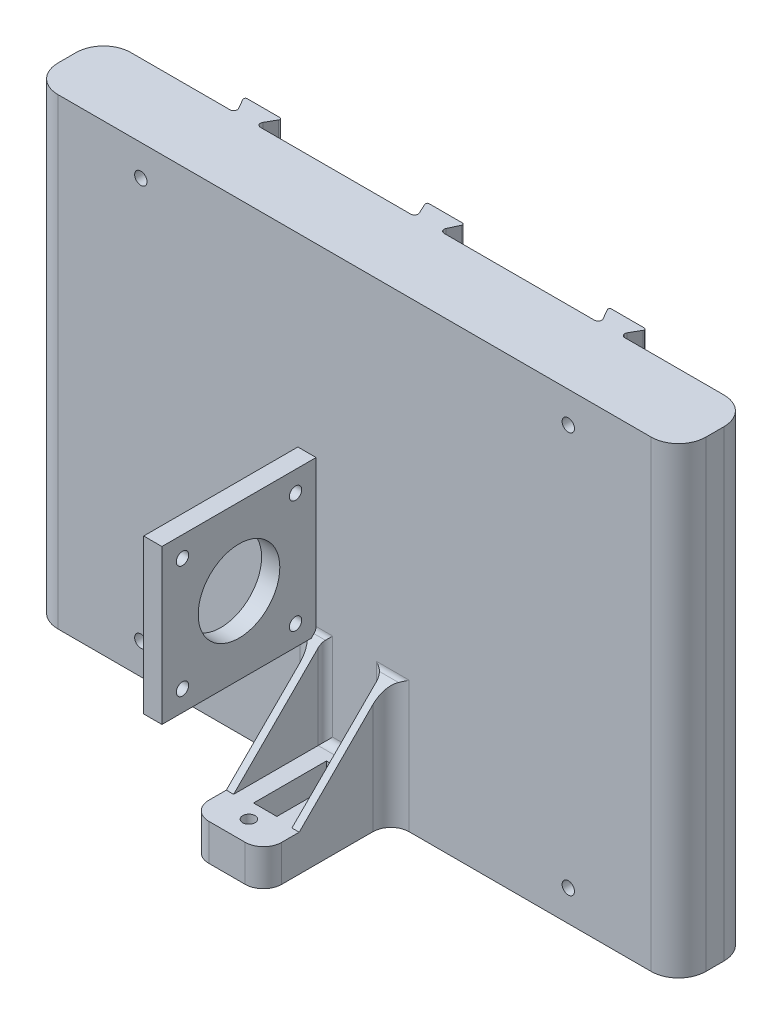
from build123d import *

# Parameters (mm, degrees)
BOSS_EXTRUDE1_DEPTH     = 127
SKETCH3_W               = 5
SKETCH3_H               = 42.3
BOSS_EXTRUDE2_DEPTH     = 42.3
SKETCH4_R               = 1.7
CUT_EXTRUDE1_DEPTH      = 5
CUT_EXTRUDE7_DEPTH      = 161.690696682
CUT_EXTRUDE7_DEPTH_BACK = 161.690696682
SKETCH5_R               = 1.7
SKETCH8_R               = 3.2
CUT_EXTRUDE8_DEPTH      = 2
SKETCH10_W              = 20
SKETCH10_H              = 10
BOSS_EXTRUDE3_DEPTH     = 35
FILLET3_R               = 5
SKETCH12_R              = 1.7
CUT_EXTRUDE9_DEPTH      = 35
RIB47_START             = -2
RIB47_DEPTH             = 2
FILLET7_R               = 5
FILLET8_R               = 2
SKETCH18_W              = 6.4
SKETCH18_H              = 20
CUT_EXTRUDE10_DEPTH     = 9
SKETCH19_W              = 5
SKETCH19_H              = 18
CUT_EXTRUDE11_DEPTH     = 4


# Read off the part's stored shape, not the designer's step: Rib47
with BuildPart() as part:
    # Sketch2 → Boss-Extrude1 (new body)
    with BuildSketch(Plane(origin=(0, 0, 0), x_dir=(1, 0, 0), z_dir=(0, 1, 0))):
        with BuildLine():
            ThreePointArc((-4.546695502, 0), (-4.968391225, -0.231350196), (-4.999849396, -0.711309131))
            Line((-4.999849396, -0.711309131), (-3.66337779, -3.577381738))
            ThreePointArc((-3.66337779, -3.577381738), (-3.726294131, -4.537299608), (-4.569685577, -5))
            Line((-4.569685577, -5), (-45.823162248, -5))
            ThreePointArc((-45.823162248, -5), (-46.689187651, -4.5), (-46.689187651, -3.5))
            Line((-46.689187651, -3.5), (-45.101474411, -0.75))
            ThreePointArc((-45.101474411, -0.75), (-45.101474411, -0.25), (-45.534487113, 0))
            Line((-45.534487113, 0), (-54.465512887, 0))
            ThreePointArc((-54.465512887, 0), (-54.898525589, -0.25), (-54.898525589, -0.75))
            Line((-54.898525589, -0.75), (-53.310812349, -3.5))
            ThreePointArc((-53.310812349, -3.5), (-53.310812349, -4.5), (-54.176837752, -5))
            Line((-54.176837752, -5), (-81.4, -5))
            ThreePointArc((-81.4, -5), (-86.703300859, -7.196699141), (-88.9, -12.5))
            Line((-88.9, -12.5), (-88.9, -17.5))
            ThreePointArc((-88.9, -17.5), (-86.703300859, -22.803300859), (-81.4, -25))
            Line((-81.4, -25), (81.4, -25))
            ThreePointArc((81.4, -25), (86.703300859, -22.803300859), (88.9, -17.5))
            Line((88.9, -17.5), (88.9, -12.5))
            ThreePointArc((88.9, -12.5), (86.703300859, -7.196699141), (81.4, -5))
            Line((81.4, -5), (54.176837752, -5))
            ThreePointArc((54.176837752, -5), (53.310812349, -4.5), (53.310812349, -3.5))
            Line((53.310812349, -3.5), (54.898525589, -0.75))
            ThreePointArc((54.898525589, -0.75), (54.898525589, -0.25), (54.465512887, 0))
            Line((54.465512887, 0), (45.534487113, 0))
            ThreePointArc((45.534487113, 0), (45.101474411, -0.25), (45.101474411, -0.75))
            Line((45.101474411, -0.75), (46.689187651, -3.5))
            ThreePointArc((46.689187651, -3.5), (46.689187651, -4.5), (45.823162248, -5))
            Line((45.823162248, -5), (4.569685577, -5))
            ThreePointArc((4.569685577, -5), (3.726294131, -4.537299608), (3.66337779, -3.577381738))
            Line((3.66337779, -3.577381738), (4.999849396, -0.711309131))
            ThreePointArc((4.999849396, -0.711309131), (4.968391225, -0.231350196), (4.546695502, 0))
            Line((4.546695502, 0), (-4.546695502, 0))
        make_face()
    extrude(amount=BOSS_EXTRUDE1_DEPTH)

    # Sketch3 → Boss-Extrude2 (add)
    with BuildSketch(Plane.XY.offset(25)):
        with Locations((-13.06, 55.018873206)):
            Rectangle(SKETCH3_W, SKETCH3_H)
    extrude(amount=BOSS_EXTRUDE2_DEPTH)

    # Sketch4 → Cut-Extrude1 (cut)
    with BuildSketch(Plane(origin=(-10.56, 0, 0), x_dir=(0, 0, -1), z_dir=(1, 0, 0))):
        with BuildLine():
            ThreePointArc((-34.95, 55.018873206), (-46.15, 66.218873206), (-57.35, 55.018873206))
            Line((-57.35, 55.018873206), (-34.95, 55.018873206))
        make_face()
        with BuildLine():
            Line((-34.95, 55.018873206), (-57.35, 55.018873206))
            ThreePointArc((-57.35, 55.018873206), (-46.15, 43.818873206), (-34.95, 55.018873206))
        make_face()
        with Locations((-61.65, 70.518873206)):
            Circle(SKETCH4_R)
        with Locations((-30.65, 70.518873206)):
            Circle(SKETCH4_R)
        with Locations((-30.65, 39.518873206)):
            Circle(SKETCH4_R)
        with Locations((-61.65, 39.518873206)):
            Circle(SKETCH4_R)
    extrude(amount=-CUT_EXTRUDE1_DEPTH, mode=Mode.SUBTRACT)

    # Sketch5 → Cut-Extrude7 (cut, two sides: drawn at the far end of the back side and taken through both)
    with BuildSketch(Plane.XY.offset(25).offset(-CUT_EXTRUDE7_DEPTH_BACK)):
        with Locations((-58.65, 118.5)):
            Circle(SKETCH5_R)
        with Locations(Location((58.65, 118.5, 0), (0, 0, 180))):
            Circle(SKETCH5_R)
        with Locations(Location((58.65, 8.5, 0), (0, 0, 180))):
            Circle(SKETCH5_R)
        with Locations((-58.65, 8.5)):
            Circle(SKETCH5_R)
    extrude(amount=CUT_EXTRUDE7_DEPTH + CUT_EXTRUDE7_DEPTH_BACK, mode=Mode.SUBTRACT)

    # Sketch8 → Cut-Extrude8 (cut)
    with BuildSketch(Plane(origin=(0, 0, 5), x_dir=(-1, 0, 0), z_dir=(0, 0, -1))):
        with Locations((-58.65, 118.5)):
            Circle(SKETCH8_R)
        with Locations((-58.65, 8.5)):
            Circle(SKETCH8_R)
        with Locations((58.65, 118.5)):
            Circle(SKETCH8_R)
        with Locations((58.65, 8.5)):
            Circle(SKETCH8_R)
    extrude(amount=-CUT_EXTRUDE8_DEPTH, mode=Mode.SUBTRACT)

    # Sketch10 → Boss-Extrude3 (add)
    with BuildSketch(Plane.XY.offset(25)):
        with Locations((0, 5)):
            Rectangle(SKETCH10_W, SKETCH10_H)
    extrude(amount=BOSS_EXTRUDE3_DEPTH)

    # Fillet3
    fillet3_edges = [part.edges().sort_by_distance(p)[0] for p in [
        (-10, 5, 60),
        (10, 5, 60),
    ]]
    fillet(fillet3_edges, radius=FILLET3_R)

    # Sketch12 → Cut-Extrude9 (cut)
    with BuildSketch(Plane(origin=(0, 10, 0), x_dir=(1, 0, 0), z_dir=(0, 1, 0))):
        with Locations(Location((0, -54, 0), (0, 0, 270))):
            Circle(SKETCH12_R)
    extrude(amount=-CUT_EXTRUDE9_DEPTH, mode=Mode.SUBTRACT)

    # Rib47 outline → Rib47 (add)
    with BuildSketch(Plane(origin=(10, 0, 0), x_dir=(0, 0, -1), z_dir=(1, 0, 0)).offset(RIB47_START)):
        Polygon((-25, 35.191123447), (-50.191123447, 10), (-25, 10), align=None)
    rib47 = extrude(amount=RIB47_DEPTH)

    # Mirror1: Rib47 across plane
    add(rib47.mirror(Plane(origin=(0, 0, 0), x_dir=(0, 0, 1), z_dir=(1, 0, 0))))

    # Fillet7
    # the kernel refuses this fillet: 5 mm, written as the material it adds along each edge
    with BuildSketch(Plane(origin=(-10, 47.691123447, 25), x_dir=(-1, 0, 0), z_dir=(0, -1, 0))) as fillet7_piece_1_section:
        with BuildLine():
            CenterArc((FILLET7_R, -FILLET7_R), FILLET7_R, 90, 90)
            Line((0, -FILLET7_R), (0, 0))
            Line((0, 0), (FILLET7_R, 0))
        make_face()
    fillet7_piece_1 = extrude(amount=47.691123447, mode=Mode.PRIVATE)
    fillet7_piece_1 = split(fillet7_piece_1, bisect_by=Plane(origin=(-11.152129269, 25.569946894, 34.621176553), z_dir=(0, -0.7071067811865476, -0.7071067811865476)), keep=Keep.TOP, mode=Mode.PRIVATE)
    add(fillet7_piece_1)
    with BuildSketch(Plane(origin=(10, 47.691123447, 25), x_dir=(0, 0, 1), z_dir=(0, -1, 0))) as fillet7_piece_2_section:
        with BuildLine():
            CenterArc((FILLET7_R, -FILLET7_R), FILLET7_R, 90, 90)
            Line((0, -FILLET7_R), (0, 0))
            Line((0, 0), (FILLET7_R, 0))
        make_face()
    fillet7_piece_2 = extrude(amount=47.691123447, mode=Mode.PRIVATE)
    fillet7_piece_2 = split(fillet7_piece_2, bisect_by=Plane(origin=(11.152129269, 25.569946894, 34.621176553), z_dir=(0, -0.7071067811865476, -0.7071067811865476)), keep=Keep.TOP, mode=Mode.PRIVATE)
    add(fillet7_piece_2)

    # Fillet8
    fillet8_edges = [part.edges().sort_by_distance(p)[0] for p in [
        (0, 10, 25),
        (8, 22.595561724, 25),
        (11.5, 35.191123447, 25),
        (-9.28, 35.191123447, 25),
        (-8, 22.595561724, 25),
    ]]
    fillet(fillet8_edges, radius=FILLET8_R)

    # Sketch18 → Cut-Extrude10 (cut)
    with BuildSketch(Plane(origin=(0, 10, 0), x_dir=(1, 0, 0), z_dir=(0, 1, 0))):
        with Locations((0, -39.517084206)):
            Rectangle(SKETCH18_W, SKETCH18_H)
    extrude(amount=-CUT_EXTRUDE10_DEPTH, mode=Mode.SUBTRACT)

    # Sketch19 → Cut-Extrude11 (cut)
    with BuildSketch(Plane(origin=(0, 1, 0), x_dir=(1, 0, 0), z_dir=(0, 1, 0))):
        with Locations((0, -40.017084206)):
            Rectangle(SKETCH19_W, SKETCH19_H)
    extrude(amount=-CUT_EXTRUDE11_DEPTH, mode=Mode.SUBTRACT)


solid = part.part
